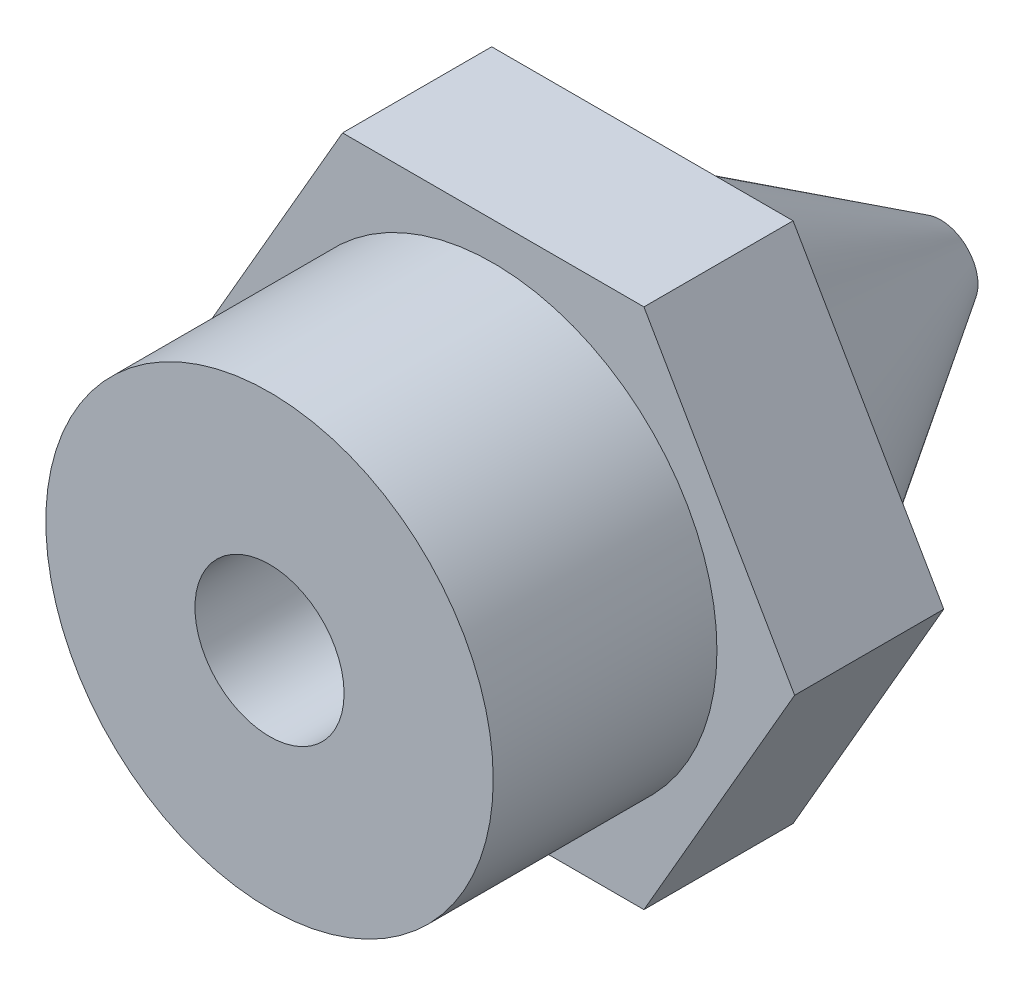
from build123d import *

# Parameters (mm, degrees)
BOSS_EXTRU_1_DEPTH      = 9
ESQUISSE2_W             = 19.623971562
ESQUISSE2_H             = 15.534154535
ESQUISSE2_R             = 3
ENL_V_MAT_EXTRU_1_DEPTH = 3
ENL_V_START             = -4
ESQUISSE3_W             = 11.267201257
ESQUISSE3_H             = 13.961169169
ESQUISSE3_R             = 3
ENL_V_MAT_EXTRU_2_DEPTH = 4
CHANFREIN1_SIZE         = 4
CHANFREIN1_SIZE_2       = 2.499477408


with BuildPart() as part:
    # Esquisse1 → Boss.-Extru.1 (new body)
    with BuildSketch(Plane.XY):
        Polygon((4.041451884, 0), (2.020725942, 3.5), (-2.020725942, 3.5), (-4.041451884, 0), (-2.020725942, -3.5), (2.020725942, -3.5), align=None)
    extrude(amount=BOSS_EXTRU_1_DEPTH)

    # Esquisse2 → Enlèv. mat.-Extru.1 (cut)
    with BuildSketch(Plane.XY.offset(9)):
        with Locations((0.327116653, -1.544441398)):
            Rectangle(ESQUISSE2_W, ESQUISSE2_H)
        Circle(ESQUISSE2_R, mode=Mode.SUBTRACT)
    extrude(amount=-ENL_V_MAT_EXTRU_1_DEPTH, mode=Mode.SUBTRACT)

    # Esquisse3 → Enlèv. mat.-Extru.2 (cut)
    with BuildSketch(Plane(origin=(0, 0, 0), x_dir=(-1, 0, 0), z_dir=(0, 0, -1)).offset(ENL_V_START)):
        with Locations((0.009770186, 0.039262349)):
            Rectangle(ESQUISSE3_W, ESQUISSE3_H)
        with Locations(Location((0, 0, 0), (0, 0, 180))):
            Circle(ESQUISSE3_R, mode=Mode.SUBTRACT)
    extrude(amount=ENL_V_MAT_EXTRU_2_DEPTH, mode=Mode.SUBTRACT)

    # Chanfrein1
    # the kernel refuses this chamfer: 4, 2.499477408 mm, written as the material it takes off along each edge
    with BuildSketch(Plane(origin=(0, 0, 0), x_dir=(1, 0, 0), z_dir=(0, 1, 0))) as chanfrein1_piece_1_section:
        Polygon((3, -CHANFREIN1_SIZE), (3 - CHANFREIN1_SIZE_2, 0), (3, 0), align=None)
    chanfrein1_piece_1 = revolve(axis=Axis((0, 0, 0), (0, 0, -1)), mode=Mode.PRIVATE)
    chanfrein1_piece_1 = split(chanfrein1_piece_1, bisect_by=Plane(origin=(-1.744026904, 0, 4), z_dir=(0, 0, -1)), keep=Keep.TOP, mode=Mode.PRIVATE)
    add(chanfrein1_piece_1, mode=Mode.SUBTRACT)

    # Esquisse4 → Enlèvement de matière-Révolution1 (revolve, cut)
    with BuildSketch(Plane(origin=(0, 0, 0), x_dir=(1, 0, 0), z_dir=(0, 1, 0))):
        Polygon((0, -9), (1, -9), (1, -6.515477142), (0.2, 0), (0, 0), align=None)
    revolve(axis=Axis((0, 0, 10.381605157), (0, 0, -1)), mode=Mode.SUBTRACT)


solid = part.part
